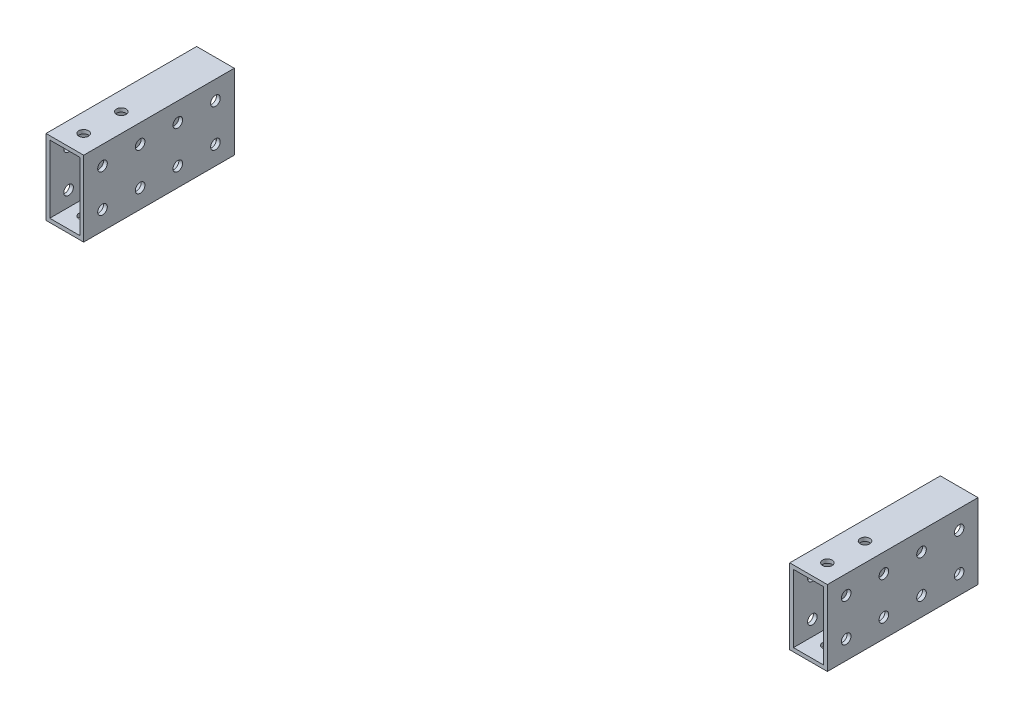
from build123d import *

# Parameters (mm, degrees)
SKETCH5_W               = 20
SKETCH5_H               = 80
SKETCH5_R               = 2.55
BOSS_EXTRUDE1_DEPTH     = 40
BOSS_EXTRUDE1_2_DEPTH   = 40
SHELL1_T                = -2
SHELL2_T                = -2
CUT_EXTRUDE1_DEPTH      = 285.846011031
CUT_EXTRUDE1_DEPTH_BACK = 285.846011031
SKETCH6_R               = 2.55


with BuildPart() as part:
    # Sketch5 → Boss-Extrude1 (new body)
    with BuildSketch(Plane(origin=(0, 0, 0), x_dir=(1, 0, 0), z_dir=(0, 1, 0))):
        with Locations((-197.5, 151)):
            Rectangle(SKETCH5_W, SKETCH5_H)
        with Locations((-197.5, 121)):
            Circle(SKETCH5_R, mode=Mode.SUBTRACT)
        with Locations((-197.5, 141)):
            Circle(SKETCH5_R, mode=Mode.SUBTRACT)
    extrude(amount=BOSS_EXTRUDE1_DEPTH)

    # Shell1
    shell1_openings = [part.faces().sort_by_distance(p)[0] for p in [
        (-197.5, 20, -191),
        (-200.05, 20, -121),
        (-200.05, 20, -141),
        (-197.5, 20, -111),
    ]]
    offset(amount=SHELL1_T, openings=shell1_openings, kind=Kind.INTERSECTION)


with BuildPart() as body_2:
    # Sketch5 → Boss-Extrude1 2 (new body)
    with BuildSketch(Plane(origin=(0, 0, 0), x_dir=(1, 0, 0), z_dir=(0, 1, 0))):
        with Locations((197.5, 151)):
            Rectangle(SKETCH5_W, SKETCH5_H)
        with Locations((197.5, 121)):
            Circle(SKETCH5_R, mode=Mode.SUBTRACT)
        with Locations((197.5, 141)):
            Circle(SKETCH5_R, mode=Mode.SUBTRACT)
    extrude(amount=BOSS_EXTRUDE1_2_DEPTH)

    # Shell2
    shell2_openings = [body_2.faces().sort_by_distance(p)[0] for p in [
        (194.95, 20, -141),
        (194.95, 20, -121),
        (197.5, 20, -111),
        (197.5, 20, -191),
    ]]
    offset(amount=SHELL2_T, openings=shell2_openings, kind=Kind.INTERSECTION)


with BuildPart() as cut_extrude1_tool:
    # Sketch6 → Cut-Extrude1 (new, two sides: drawn at the far end of the back side and taken through both)
    with BuildSketch(Plane.ZY.offset(-CUT_EXTRUDE1_DEPTH_BACK)):
        with Locations((-141, 30)):
            Circle(SKETCH6_R)
        with Locations((-141, 10)):
            Circle(SKETCH6_R)
        with Locations((-161, 10)):
            Circle(SKETCH6_R)
        with Locations((-181, 10)):
            Circle(SKETCH6_R)
        with Locations((-181, 30)):
            Circle(SKETCH6_R)
        with Locations((-161, 30)):
            Circle(SKETCH6_R)
        with Locations((-121, 10)):
            Circle(SKETCH6_R)
        with Locations((-121, 30)):
            Circle(SKETCH6_R)
    extrude(amount=CUT_EXTRUDE1_DEPTH + CUT_EXTRUDE1_DEPTH_BACK)


with BuildPart() as part_1:
    add(part.part)

    # Cut-Extrude1: cut by cut_extrude1_tool
    add(cut_extrude1_tool.part, mode=Mode.SUBTRACT)


with BuildPart() as body_2_1:
    add(body_2.part)

    # Cut-Extrude1: cut by cut_extrude1_tool
    add(cut_extrude1_tool.part, mode=Mode.SUBTRACT)


solid = Compound([part_1.part, body_2_1.part])
